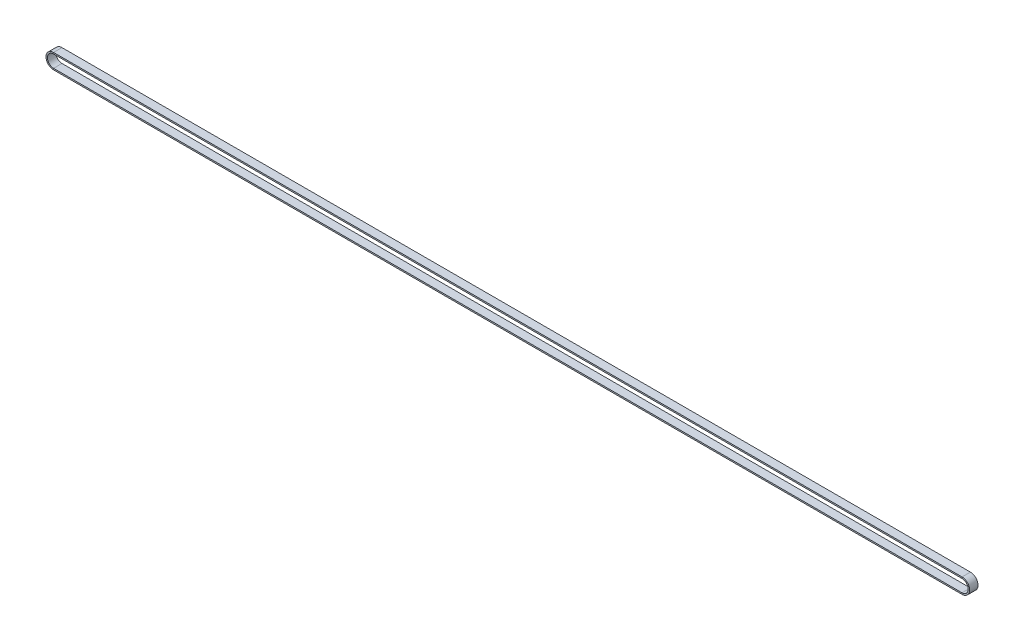
from build123d import *

# Parameters (mm, degrees)
SKETCH3_W = 9
SKETCH3_H = 1.5


with BuildPart() as part:
    # Sweep1: sweep along a path in Sketch2
    with BuildLine(Plane.XY) as sweep1_path:
        Line((632.867575219, -1418.56263664), (-343.463325095, -1418.56263664))
        ThreePointArc((-343.463325095, -1418.56263664), (-351.603075095, -1410.42288664), (-343.463325095, -1402.28313664))
        Line((-343.463325095, -1402.28313664), (632.867575219, -1402.28313664))
        ThreePointArc((632.867575219, -1402.28313664), (641.007325219, -1410.42288664), (632.867575219, -1418.56263664))
    # Sketch3 → Sweep1 (sweep)
    with BuildSketch(Plane(origin=(632.867575219, -1402.28313664, 0), x_dir=(0, 0, -1), z_dir=(1, 0, 0))):
        with Locations((4.5, -0.75)):
            Rectangle(SKETCH3_W, SKETCH3_H)
    sweep(path=sweep1_path.line)


solid = part.part
